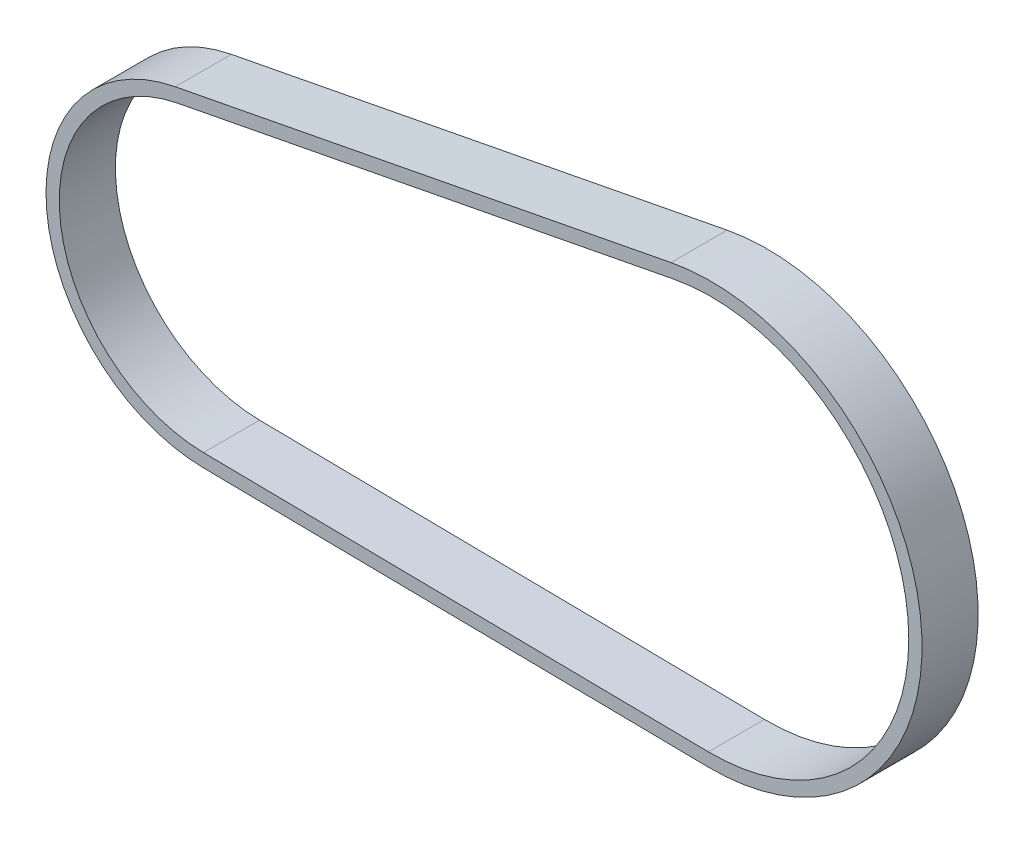
from build123d import *

# Parameters (mm, degrees)
EXTRUDE_THIN1_DEPTH = 3.175


with BuildPart() as part:
    # Sketch2 → Extrude-Thin1 (new, symmetric)
    with BuildSketch(Plane.XY):
        with BuildLine():
            Line((-3.415304739, 17.707649464), (52.664876605, 28.523930276))
            ThreePointArc((52.664876605, 28.523930276), (80.968897151, 7.192635581), (56.868215936, -18.793877794))
            Line((56.868215936, -18.793877794), (-0.240442053, -18.032397057))
            ThreePointArc((-0.240442053, -18.032397057), (-17.963263971, -1.595714109), (-3.415304739, 17.707649464))
        make_face()
        with BuildLine():
            Line((-3.131232592, 16.234794069), (52.948948753, 27.051074881))
            ThreePointArc((52.948948753, 27.051074881), (79.474780707, 7.059910109), (56.888214997, -17.29401112))
            Line((56.888214997, -17.29401112), (-0.220442992, -16.532530384))
            ThreePointArc((-0.220442992, -16.532530384), (-16.469147526, -1.462988637), (-3.131232592, 16.234794069))
        make_face(mode=Mode.SUBTRACT)
    extrude(amount=EXTRUDE_THIN1_DEPTH, both=True)


solid = part.part
